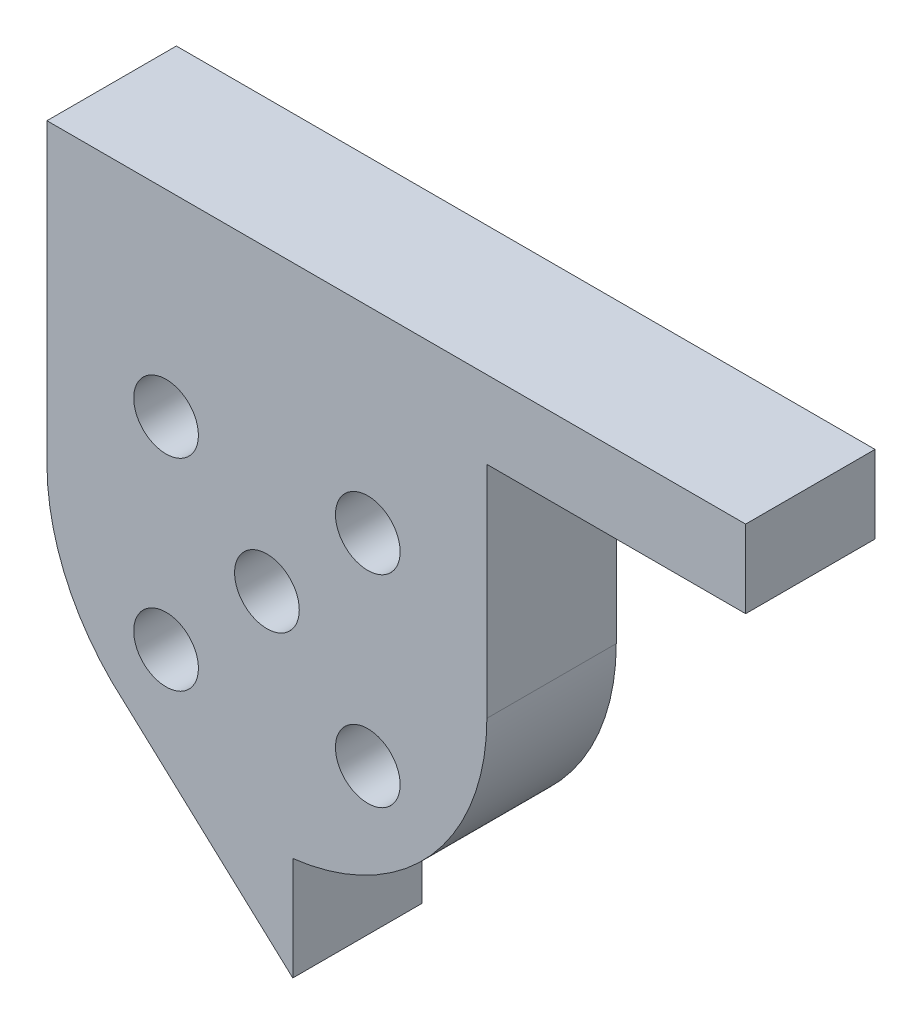
from build123d import *

# Parameters (mm, degrees)
SKETCH1_R           = 1.5875
BOSS_EXTRUDE1_DEPTH = 6.35


with BuildPart() as part:
    # Sketch1 → Boss-Extrude1 (new body)
    with BuildSketch(Plane.XY):
        with BuildLine():
            Line((10.795, 0), (10.795, 10.795))
            Line((10.795, 10.795), (23.495, 10.795))
            Line((23.495, 10.795), (23.495, 14.605))
            Line((23.495, 14.605), (-10.795, 14.605))
            Line((-10.795, 14.605), (-10.795, 0))
            ThreePointArc((-10.795, 0), (-9.969702227, -4.139693527), (-7.62, -7.646412558))
            Line((-7.62, -7.646412558), (1.27, -15.800033815))
            Line((1.27, -15.800033815), (1.27, -10.720033815))
            ThreePointArc((1.27, -10.720033815), (8.069748292, -7.170159517), (10.795, 0))
        make_face()
        Circle(SKETCH1_R, mode=Mode.SUBTRACT)
        with Locations((-4.95, 4.95)):
            Circle(SKETCH1_R, mode=Mode.SUBTRACT)
        with Locations((-4.95, -4.95)):
            Circle(SKETCH1_R, mode=Mode.SUBTRACT)
        with Locations((4.95, -4.95)):
            Circle(SKETCH1_R, mode=Mode.SUBTRACT)
        with Locations((4.95, 4.95)):
            Circle(SKETCH1_R, mode=Mode.SUBTRACT)
    extrude(amount=BOSS_EXTRUDE1_DEPTH)


solid = part.part
